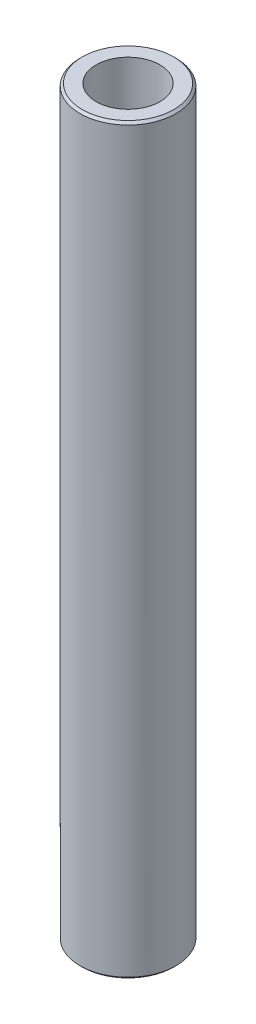
from build123d import *

# Parameters (mm, degrees)
SKETCH1_R           = 30
BOSS_EXTRUDE1_DEPTH = 464.065258487
SKETCH2_R           = 19.963312556
CUT_EXTRUDE1_DEPTH  = 467.000605294
CHAMFER1_SIZE       = 1.439880077


with BuildPart() as part:
    # Sketch1 → Boss-Extrude1 (new body)
    with BuildSketch(Plane(origin=(0, 0, 0), x_dir=(1, 0, 0), z_dir=(0, 1, 0))):
        Circle(SKETCH1_R)
    extrude(amount=BOSS_EXTRUDE1_DEPTH)

    # Sketch2 → Cut-Extrude1 (cut, through all)
    with BuildSketch(Plane(origin=(0, 0, 0), x_dir=(1, 0, 0), z_dir=(0, 1, 0))):
        Circle(SKETCH2_R)
    extrude(amount=CUT_EXTRUDE1_DEPTH, mode=Mode.SUBTRACT)

    # Chamfer1
    chamfer1_edges = [part.edges().sort_by_distance(p)[0] for p in [
        (-30, 464.065258487, 0),
        (-30, 0, 0),
    ]]
    chamfer(chamfer1_edges, length=CHAMFER1_SIZE)


solid = part.part
